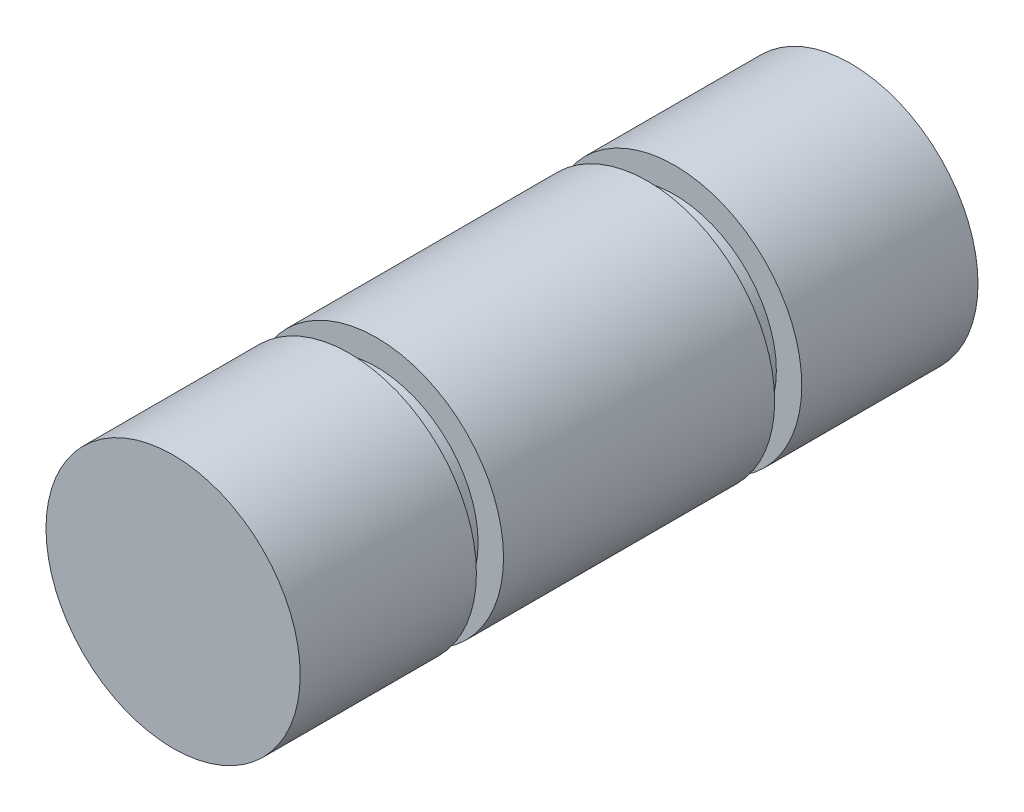
from build123d import *

# Parameters (mm, degrees)
SKETCH1_R           = 4.7625
BOSS_EXTRUDE1_DEPTH = 12.7
SKETCH2_W           = 0.9525
SKETCH2_H           = 1.016


with BuildPart() as part:
    # Sketch1 → Boss-Extrude1 (new, symmetric)
    with BuildSketch(Plane.XY):
        Circle(SKETCH1_R)
    extrude(amount=BOSS_EXTRUDE1_DEPTH, both=True)

    # Sketch2 → Cut-Revolve1 (revolve, cut)
    with BuildSketch(Plane(origin=(0, 0, 0), x_dir=(1, 0, 0), z_dir=(0, 1, 0))):
        with Locations((4.28625, 5.588)):
            Rectangle(SKETCH2_W, SKETCH2_H)
        with Locations((4.28625, -5.588)):
            Rectangle(SKETCH2_W, SKETCH2_H)
    revolve(axis=Axis((0, 0, 12.7), (0, 0, -1)), mode=Mode.SUBTRACT)


solid = part.part
